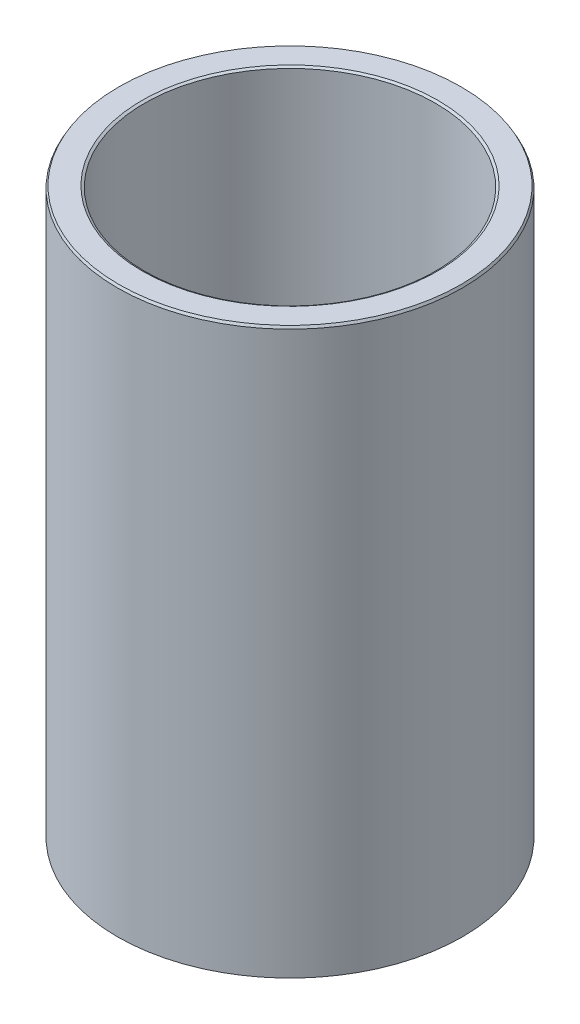
from build123d import *
from OCP.BRepFilletAPI import BRepFilletAPI_MakeChamfer

# Parameters (mm, degrees)
SKETCH1_R           = 52.5
BOSS_EXTRUDE1_DEPTH = 172.152970547
SKETCH2_R           = 44.277514729
CUT_EXTRUDE1_DEPTH  = 188.481053091
CHAMFER1_SIZE       = 0.716629977
CHAMFER1_SIZE2      = 0.41374651


with BuildPart() as part:
    # Sketch1 → Boss-Extrude1 (new body)
    with BuildSketch(Plane(origin=(0, 0, 0), x_dir=(1, 0, 0), z_dir=(0, 1, 0))):
        Circle(SKETCH1_R)
    extrude(amount=BOSS_EXTRUDE1_DEPTH)

    # Sketch2 → Cut-Extrude1 (cut, through all)
    with BuildSketch(Plane(origin=(0, 0, 0), x_dir=(1, 0, 0), z_dir=(0, 1, 0))):
        Circle(SKETCH2_R)
    extrude(amount=CUT_EXTRUDE1_DEPTH, mode=Mode.SUBTRACT)

    # Chamfer1: one chamfer whose edges measure the first distance from different faces: ONE call of the kernel's chamfer builder (chamfer() names one face for all edges)
    chamfer1_edges_1 = [part.edges().sort_by_distance(p)[0] for p in [
        (-44.277514729, 172.152970547, 0),
    ]]
    chamfer1_side_1 = [part.faces().sort_by_distance(p)[0] for p in [
        (-51.01507576, 172.152970547, 0),
    ]]
    chamfer1_edges_2 = [part.edges().sort_by_distance(p)[0] for p in [
        (-44.277514729, 0, 0),
    ]]
    chamfer1_side_2 = [part.faces().sort_by_distance(p)[0] for p in [
        (-44.277514729, 86.076485273, 0),
    ]]
    chamfer1_edges_3 = [part.edges().sort_by_distance(p)[0] for p in [
        (-52.5, 0, 0),
    ]]
    chamfer1_side_3 = [part.faces().sort_by_distance(p)[0] for p in [
        (-51.01507576, 0, 0),
    ]]
    chamfer1_edges_4 = [part.edges().sort_by_distance(p)[0] for p in [
        (-52.5, 172.152970547, 0),
    ]]
    chamfer1_side_4 = [part.faces().sort_by_distance(p)[0] for p in [
        (-52.5, 86.076485273, 0),
    ]]
    chamfer1 = BRepFilletAPI_MakeChamfer(part.part.solid().wrapped)
    for e in chamfer1_edges_1:
        chamfer1.Add(CHAMFER1_SIZE, CHAMFER1_SIZE2, e.wrapped, chamfer1_side_1[0].wrapped)  # the first distance lies on this face
    for e in chamfer1_edges_2:
        chamfer1.Add(CHAMFER1_SIZE, CHAMFER1_SIZE2, e.wrapped, chamfer1_side_2[0].wrapped)  # the first distance lies on this face
    for e in chamfer1_edges_3:
        chamfer1.Add(CHAMFER1_SIZE, CHAMFER1_SIZE2, e.wrapped, chamfer1_side_3[0].wrapped)  # the first distance lies on this face
    for e in chamfer1_edges_4:
        chamfer1.Add(CHAMFER1_SIZE, CHAMFER1_SIZE2, e.wrapped, chamfer1_side_4[0].wrapped)  # the first distance lies on this face
    add(Compound.cast(chamfer1.Shape()), mode=Mode.REPLACE)


solid = part.part
